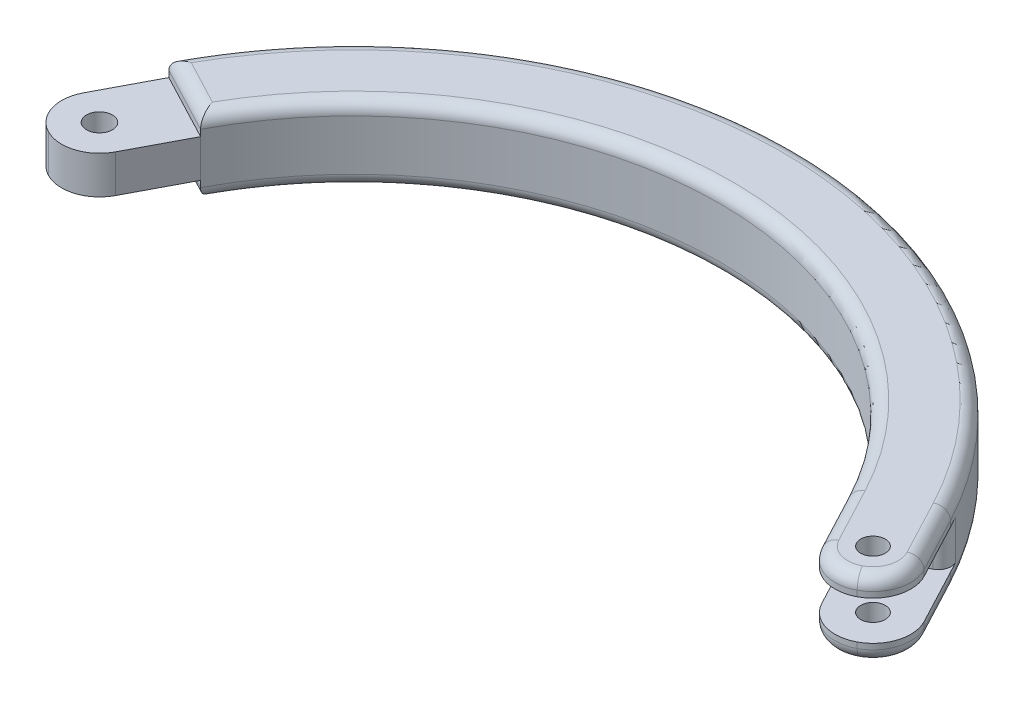
from build123d import *

# Parameters (mm, degrees)
BOSS_EXTRUDE1_DEPTH = 6
CUT_EXTRUDE1_DEPTH  = 6
SKETCH3_W           = 6
SKETCH3_H           = 6
BOSS_EXTRUDE2_DEPTH = 8
SKETCH5_W           = 8
SKETCH5_H           = 3.1
CUT_EXTRUDE2_DEPTH  = 8
SKETCH6_R           = 0.975
CUT_EXTRUDE3_DEPTH  = 8
SKETCH7_W           = 6
SKETCH7_H           = 3
BOSS_EXTRUDE3_DEPTH = 8
SKETCH8_R           = 1.025
CUT_EXTRUDE4_DEPTH  = 8
FILLET1_R           = 3
FILLET2_R           = 1


with BuildPart() as part:
    # Sketch1 → Boss-Extrude1 (new body)
    with BuildSketch(Plane(origin=(0, 0, 0), x_dir=(1, 0, 0), z_dir=(0, 1, 0))):
        with BuildLine():
            ThreePointArc((59.197580629, 1.463473077), (28.251548273, 20.077561964), (-2.65465833, 1.397422323))
            ThreePointArc((-2.65465833, 1.397422323), (-1.397422323, -2.65465833), (2.65465833, -1.397422323))
            ThreePointArc((2.65465833, -1.397422323), (28.257955548, 14.077565385), (53.894245187, -1.342704605))
            ThreePointArc((53.894245187, -1.342704605), (57.949001749, -2.591283485), (59.197580629, 1.463473077))
        make_face()
    extrude(amount=BOSS_EXTRUDE1_DEPTH)

    # Sketch2 → Cut-Extrude1 (cut)
    with BuildSketch(Plane(origin=(0, 6, 0), x_dir=(1, 0, 0), z_dir=(0, 1, 0))):
        Polygon((53.894245187, -1.342704605), (59.197580629, 1.463473077), (61.240293877, -2.397007189), (55.867953369, -5.072773667), align=None)
        Polygon((2.65465833, -1.397422323), (-2.65465833, 1.397422323), (-5.113209947, -2.397007189), (1.520441913, -5.715494495), align=None)
    extrude(amount=-CUT_EXTRUDE1_DEPTH, mode=Mode.SUBTRACT)

    # Sketch3 → Boss-Extrude2 (add)
    with BuildSketch(Plane(origin=(12.343879945, 0, 23.328435834), x_dir=(0.883889240381717, 0, -0.46769628044002154), z_dir=(0.4676962804400216, 0, 0.8838892403817171))):
        with Locations((50.008565489, 3)):
            Rectangle(SKETCH3_W, SKETCH3_H)
    extrude(amount=BOSS_EXTRUDE2_DEPTH)

    # Sketch5 → Cut-Extrude2 (cut)
    with BuildSketch(Plane(origin=(46.853700684, 0, -24.791908911), x_dir=(-0.46769628044002165, 0, -0.883889240381717), z_dir=(0.883889240381717, 0, -0.46769628044002165))):
        with Locations((-30.392940165, 3)):
            Rectangle(SKETCH5_W, SKETCH5_H)
    extrude(amount=-CUT_EXTRUDE2_DEPTH, mode=Mode.SUBTRACT)

    # Sketch6 → Cut-Extrude3 (cut)
    with BuildSketch(Plane(origin=(0, 6, 0), x_dir=(1, 0, 0), z_dir=(0, 1, 0))):
        with Locations(Location((58.88439431, -4.359061966, 0), (0, 0, 270))):
            Circle(SKETCH6_R)
    extrude(amount=-CUT_EXTRUDE3_DEPTH, mode=Mode.SUBTRACT)

    # Sketch7 → Boss-Extrude3 (add)
    with BuildSketch(Plane(origin=(0, 0, 0), x_dir=(0.8848861101120022, 0, 0.4658074410428085), z_dir=(-0.4658074410428085, 0, 0.8848861101120022))):
        with Locations((0, 3)):
            Rectangle(SKETCH7_W, SKETCH7_H)
    extrude(amount=BOSS_EXTRUDE3_DEPTH)

    # Sketch8 → Cut-Extrude4 (cut)
    with BuildSketch(Plane(origin=(0, 4.5, 0), x_dir=(1, 0, 0), z_dir=(0, 1, 0))):
        with Locations(Location((-2.329037205, -4.424430551, 0), (0, 0, 180))):
            Circle(SKETCH8_R)
    extrude(amount=-CUT_EXTRUDE4_DEPTH, mode=Mode.SUBTRACT)

    # Fillet1
    fillet1_edges = [part.edges().sort_by_distance(p)[0] for p in [
        (57.63581543, 5.275, 8.413818528),
        (57.63581543, 0.725, 8.413818528),
        (62.939150873, 0.725, 5.607640846),
        (62.939150873, 5.275, 5.607640846),
        (-1.071801198, 3, 8.476511204),
        (-6.381117859, 3, 5.681666558),
    ]]
    fillet(fillet1_edges, radius=FILLET1_R - 0.0001)  # a hair under: the kernel refuses the full size

    # Fillet2
    fillet2_edges = [part.edges().sort_by_distance(p)[0] for p in [
        (28.251548273, 0, -20.077561964),
        (28.251548273, 6, -20.077561964),
        (60.366844715, 0, 0.746294218),
        (61.751579759, 0, 5.241952749),
        (58.001503527, 0, 7.226247414),
        (55.063509273, 0, 3.552471901),
        (60.366844715, 6, 0.746294218),
        (61.751579759, 6, 5.241952749),
        (58.001503527, 6, 7.226247414),
        (55.063509273, 6, 3.552471901),
        (53.894245187, 3, 1.342704605),
        (59.197580629, 3, -1.463473077),
        (0, 0, 0),
        (0, 6, 0),
        (28.257955548, 0, -14.077565385),
        (28.257955548, 6, -14.077565385),
    ]]
    fillet(fillet2_edges, radius=FILLET2_R)


solid = part.part
